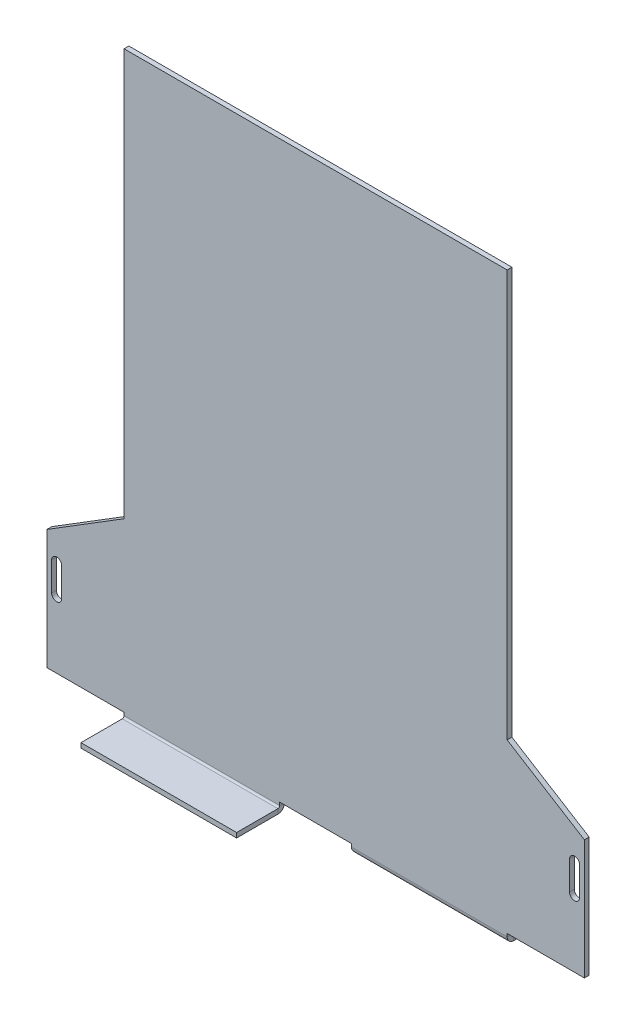
from build123d import *

# Parameters (mm, degrees)
BASE_FLANGE1_DEPTH           = 2
EDGE_FLANGE1_STRIP_W         = 9.4732
EDGE_FLANGE1_STRIP_H         = 2
EDGE_FLANGE1_STRIP_CUT_DEPTH = 65
EDGE_FLANGE1_DEPTH           = 65
EDGE_FLANGE2_STRIP_W         = 9.4732
EDGE_FLANGE2_STRIP_H         = 2
EDGE_FLANGE2_STRIP_CUT_DEPTH = 65
EDGE_FLANGE2_DEPTH           = 65


# Sheet-metal steps are written as plain solids
with BuildPart() as part:
    # Sketch1 → Base-Flange1 (new body)
    with BuildSketch(Plane.XY):
        Polygon((-80, 206), (-80, 36), (-112.26, 16), (-112.26, -34), (-80, -34), (-80, -38), (-15, -38), (-15, -34), (15, -34), (15, -38), (80, -38), (80, -34), (112.26, -34), (112.26, 16), (80, 36), (80, 206), align=None)
        with BuildLine():
            Line((-110.26, -6), (-110.26, 6))
            ThreePointArc((-110.26, 6), (-108.16, 8.1), (-106.06, 6))
            Line((-106.06, 6), (-106.06, -6))
            ThreePointArc((-106.06, -6), (-108.16, -8.1), (-110.26, -6))
        make_face(mode=Mode.SUBTRACT)
        with BuildLine():
            Line((106.06, -6), (106.06, 6))
            ThreePointArc((106.06, 6), (108.16, 8.1), (110.26, 6))
            Line((110.26, 6), (110.26, -6))
            ThreePointArc((110.26, -6), (108.16, -8.1), (106.06, -6))
        make_face(mode=Mode.SUBTRACT)
    extrude(amount=-BASE_FLANGE1_DEPTH)

    # Edge-Flange1 strip (across the edge) → Edge-Flange1 strip cut (cut)
    with BuildSketch(Plane(origin=(-80, -38, 0), x_dir=(0, 1, 0), z_dir=(1, 0, 0))):
        with Locations((-2, -1)):
            Rectangle(EDGE_FLANGE1_STRIP_W, EDGE_FLANGE1_STRIP_H)
    extrude(amount=EDGE_FLANGE1_STRIP_CUT_DEPTH, mode=Mode.SUBTRACT)

    # Edge-Flange1 section (across the edge) → Edge-Flange1 (add)
    with BuildSketch(Plane(origin=(-80, -38, 0), x_dir=(0, 1, 0), z_dir=(1, 0, 0))):
        with BuildLine():
            Line((0, 0.7366), (0, 18))
            Line((0, 18), (2, 18))
            Line((2, 18), (2, 0.7366))
            ThreePointArc((2, 0.7366), (2.215745145, 0.215745145), (2.7366, 0))
            Line((2.7366, 0), (2.7366, -2))
            ThreePointArc((2.7366, -2), (0.801531583, -1.198468417), (0, 0.7366))
        make_face()
    extrude(amount=EDGE_FLANGE1_DEPTH)

    # Edge-Flange2 strip (across the edge) → Edge-Flange2 strip cut (cut)
    with BuildSketch(Plane(origin=(80, -38, -2), x_dir=(0, 1, 0), z_dir=(-1, 0, 0))):
        with Locations((-2, -1)):
            Rectangle(EDGE_FLANGE2_STRIP_W, EDGE_FLANGE2_STRIP_H)
    extrude(amount=EDGE_FLANGE2_STRIP_CUT_DEPTH, mode=Mode.SUBTRACT)

    # Edge-Flange2 section (across the edge) → Edge-Flange2 (add)
    with BuildSketch(Plane(origin=(80, -38, -2), x_dir=(0, 1, 0), z_dir=(-1, 0, 0))):
        with BuildLine():
            Line((0, 0.7366), (0, 18))
            Line((0, 18), (2, 18))
            Line((2, 18), (2, 0.7366))
            ThreePointArc((2, 0.7366), (2.215745145, 0.215745145), (2.7366, 0))
            Line((2.7366, 0), (2.7366, -2))
            ThreePointArc((2.7366, -2), (0.801531583, -1.198468417), (0, 0.7366))
        make_face()
    extrude(amount=EDGE_FLANGE2_DEPTH)


solid = part.part
